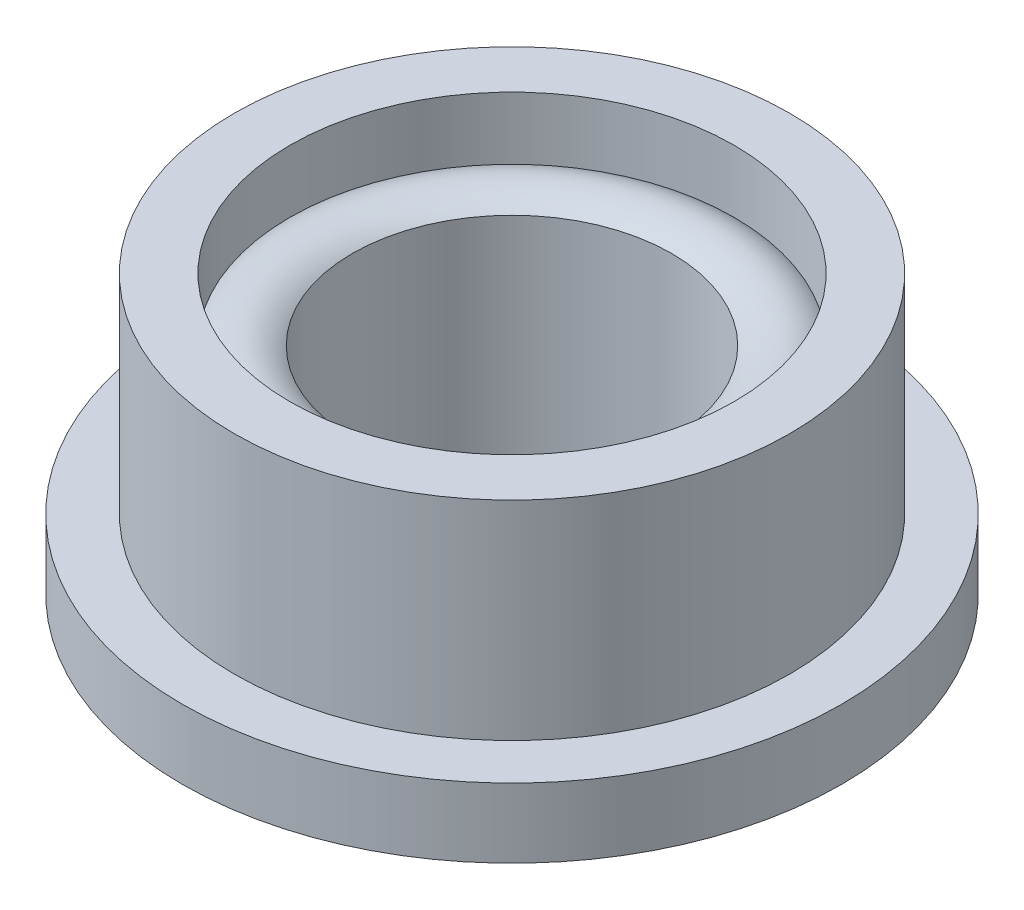
from build123d import *

# Parameters (mm, degrees)
SKETCH2_R           = 4.75
SKETCH2_R_2         = 1.5
BOSS_EXTRUDE1_DEPTH = 1
SKETCH3_R           = 4
SKETCH3_R_2         = 1.5
BOSS_EXTRUDE2_DEPTH = 3
SKETCH4_R           = 3.2
SKETCH4_R_2         = 2.3
CUT_EXTRUDE1_DEPTH  = 0.9
SKETCH6_R           = 2.3
SKETCH6_R_2         = 1.5
CUT_EXTRUDE3_DEPTH  = 10


with BuildPart() as part:
    # Sketch2 → Boss-Extrude1 (new body)
    with BuildSketch(Plane(origin=(0, 0, 0), x_dir=(1, 0, 0), z_dir=(0, 1, 0))):
        Circle(SKETCH2_R)
        Circle(SKETCH2_R_2, mode=Mode.SUBTRACT)
    extrude(amount=BOSS_EXTRUDE1_DEPTH)

    # Sketch3 → Boss-Extrude2 (add)
    with BuildSketch(Plane(origin=(0, 1, 0), x_dir=(1, 0, 0), z_dir=(0, 1, 0))):
        Circle(SKETCH3_R)
        Circle(SKETCH3_R_2, mode=Mode.SUBTRACT)
    extrude(amount=BOSS_EXTRUDE2_DEPTH)

    # Sketch4 → Cut-Extrude1 (cut)
    with BuildSketch(Plane(origin=(0, 4, 0), x_dir=(1, 0, 0), z_dir=(0, 1, 0))):
        Circle(SKETCH4_R)
        Circle(SKETCH4_R_2, mode=Mode.SUBTRACT)
    extrude(amount=-CUT_EXTRUDE1_DEPTH, mode=Mode.SUBTRACT)

    # Sketch5 → Revolve1 (revolve)
    with BuildSketch(Plane(origin=(0, 0, 0), x_dir=(0, 0, -1), z_dir=(1, 0, 0))):
        with BuildLine():
            Line((-3.2, 3.1), (-2.3, 3.1))
            ThreePointArc((-2.3, 3.1), (-2.75, 3.25), (-3.2, 3.1))
        make_face()
    revolve(axis=Axis((0, 4, 0), (0, -1, 0)))

    # Sketch6 → Cut-Extrude3 (cut)
    with BuildSketch(Plane(origin=(0, 4, 0), x_dir=(1, 0, 0), z_dir=(0, 1, 0))):
        Circle(SKETCH6_R)
        Circle(SKETCH6_R_2, mode=Mode.SUBTRACT)
    extrude(amount=-CUT_EXTRUDE3_DEPTH, mode=Mode.SUBTRACT)


solid = part.part
